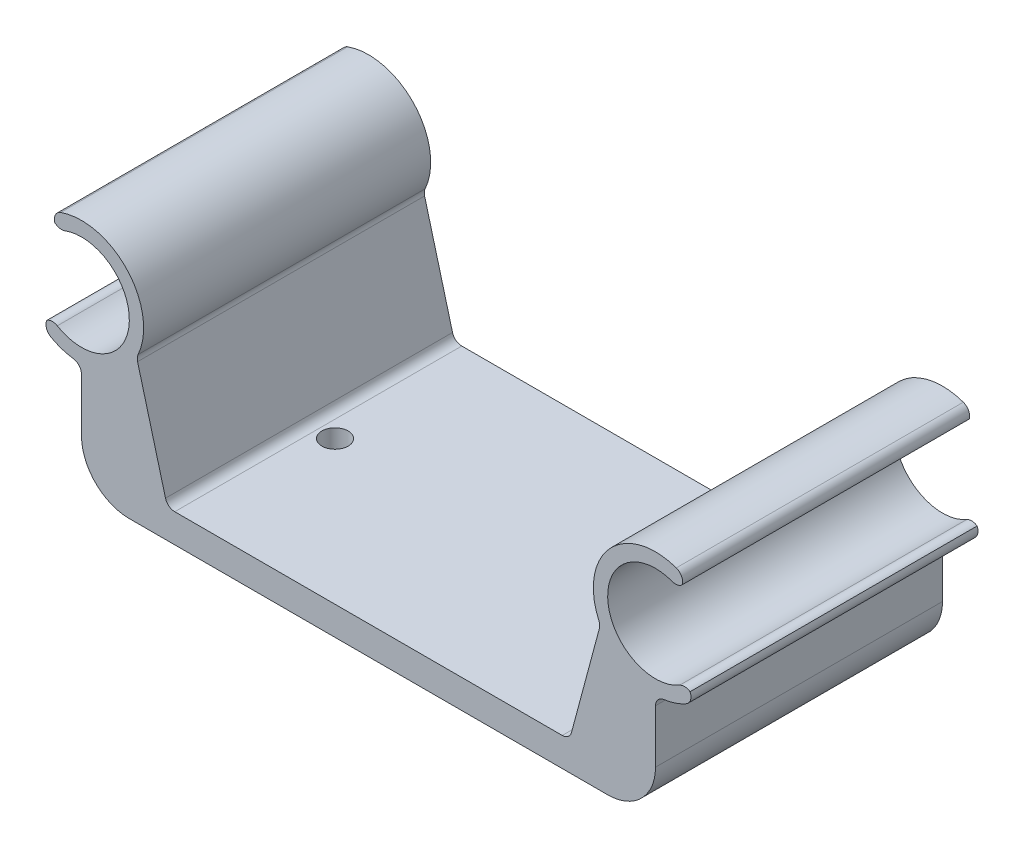
from build123d import *

# Parameters (mm, degrees)
BOSS_EXTRUDE1_DEPTH             = 3
CUT_EXTRUDE1_REACH              = 35.675
SKETCH2_R                       = 1.3750000000000009
BOSS_EXTRUDE2_REACH             = 35.675
BOSS_EXTRUDE2_DIRECTION_2_REACH = 35.675
FILLET3_R                       = 1
FILLET3_OF_MIRROR2_R            = 1
FILLET6_R                       = 5
FILLET7_R                       = 1


with BuildPart() as part:
    # Sketch1 → Boss-Extrude1 (new body)
    with BuildSketch(Plane(origin=(0, 0, 0), x_dir=(1, 0, 0), z_dir=(0, 1, 0))):
        Polygon((30, -14.999999999999993), (-29.999999999999996, -15.000000000000002), (-29.999999999999996, 14.999999999999998), (30.000000000000004, 15.000000000000005), align=None)
    extrude(amount=BOSS_EXTRUDE1_DEPTH)

    # Sketch2 → Cut-Extrude1 (cut, up to next)
    with BuildSketch(Plane(origin=(0, 3, 0), x_dir=(1, 0, 0), z_dir=(0, 1, 0)), mode=Mode.PRIVATE) as cut_extrude1_sk1:
        with Locations(Location((-18.5, 0, 0), (0, 0, 270))):
            Circle(SKETCH2_R)
    cut_extrude1_tool1 = extrude(cut_extrude1_sk1.sketch, amount=-CUT_EXTRUDE1_REACH, mode=Mode.PRIVATE) & part.part
    cut_extrude1 = cut_extrude1_tool1.solids().sort_by_distance((-18.5, 3, 0))[0]
    add(cut_extrude1, mode=Mode.SUBTRACT)

    # Mirror1: Cut-Extrude1 across plane
    add(cut_extrude1.mirror(Plane(origin=(0, 0, 0), x_dir=(0, 0, 1), z_dir=(1, 0, 0))), mode=Mode.SUBTRACT)

    # Boss-Extrude2: up to this face of the body (flat: up to its plane)
    boss_extrude2_end = Plane(part.part.faces().sort_by_distance((0, 1.5, 15))[0])
    # Sketch3 → Boss-Extrude2 (add, up to the picked face)
    with BuildSketch(Plane.XY, mode=Mode.PRIVATE) as boss_extrude2_sk1:
        with BuildLine():
            Line((24.23371870266459, 15.000000000000002), (21.01832839349107, 3))
            Line((21.01832839349107, 3), (30, 3))
            Line((30, 3), (29.999999999999996, 11.500000000107407))
            ThreePointArc((29.999999999999996, 11.500000000107407), (32.223130931464034, 11.891997965331278), (34.17811946267373, 13.020711120091907))
            Line((34.17811946267373, 13.020711120091907), (33.213938048141515, 14.169777784768357))
            ThreePointArc((33.213938048141515, 14.169777784768357), (25.019026509541703, 17.564221286256522), (32.50000000000003, 22.3301270189222))
            Line((32.50000000000003, 22.3301270189222), (33.250000000000036, 23.62916512459886))
            ThreePointArc((33.250000000000036, 23.62916512459886), (25.505721350569345, 22.695898148519827), (24.23371870266459, 15.000000000000002))
        make_face()
    boss_extrude2_tool1 = split(extrude(boss_extrude2_sk1.sketch, amount=BOSS_EXTRUDE2_REACH, mode=Mode.PRIVATE), bisect_by=boss_extrude2_end, keep=Keep.BOTH, mode=Mode.PRIVATE)
    boss_extrude2 = boss_extrude2_tool1.solids().sort_by(Axis((26.59731, 11.034621, 0), (0, 0, 1)))[0]
    add(boss_extrude2)

    # Boss-Extrude2 direction 2: up to this face of the body (flat: up to its plane)
    boss_extrude2_direction_2_end = Plane(part.part.faces().sort_by_distance((0, 1.5, -15))[0])
    # Sketch3 → Boss-Extrude2 direction 2 (add, up to the picked face)
    with BuildSketch(Plane.XY, mode=Mode.PRIVATE) as boss_extrude2_direction_2_sk1:
        with BuildLine():
            Line((24.23371870266459, 15.000000000000002), (21.01832839349107, 3))
            Line((21.01832839349107, 3), (30, 3))
            Line((30, 3), (29.999999999999996, 11.500000000107407))
            ThreePointArc((29.999999999999996, 11.500000000107407), (32.223130931464034, 11.891997965331278), (34.17811946267373, 13.020711120091907))
            Line((34.17811946267373, 13.020711120091907), (33.213938048141515, 14.169777784768357))
            ThreePointArc((33.213938048141515, 14.169777784768357), (25.019026509541703, 17.564221286256522), (32.50000000000003, 22.3301270189222))
            Line((32.50000000000003, 22.3301270189222), (33.250000000000036, 23.62916512459886))
            ThreePointArc((33.250000000000036, 23.62916512459886), (25.505721350569345, 22.695898148519827), (24.23371870266459, 15.000000000000002))
        make_face()
    boss_extrude2_direction_2_tool1 = split(extrude(boss_extrude2_direction_2_sk1.sketch, amount=-BOSS_EXTRUDE2_DIRECTION_2_REACH, mode=Mode.PRIVATE), bisect_by=boss_extrude2_direction_2_end, keep=Keep.BOTH, mode=Mode.PRIVATE)
    boss_extrude2_direction_2 = boss_extrude2_direction_2_tool1.solids().sort_by(Axis((26.59731, 11.034621, 0), (0, 0, -1)))[0]
    add(boss_extrude2_direction_2)

    # Fillet3
    # the kernel refuses this fillet: 1 mm, written as the material it adds along each edge
    with BuildSketch(Plane(origin=(29.999999999999996, 11.500000000107406, -15.000000000000002), x_dir=(0.9977653155349889, 0.06681597949116533, 0), z_dir=(0, 0, 1))) as fillet3_piece_1:
        with BuildLine():
            CenterArc((0.9354237099720605, -0.99776531555048), FILLET3_R, 93.83112782826316, 82.33774433018942)
            Line((-0.06234160556292847, -0.9309493360593146), (0, 0))
            ThreePointArc((0, 0), (0.4343038653561172, -0.01452544892746713), (0.8686077307122309, -1e-17))
        make_face()
    extrude(amount=30)
    # the kernel refuses this fillet: 1 mm, written as the material it takes off along each edge
    with BuildSketch(Plane(origin=(33.250000000000036, 23.62916512459886, 17.96693441323381), x_dir=(-0.9080543065649367, 0.4188524517403138, 0), z_dir=(0, 0, -1))) as fillet3_2_piece_1:
        with BuildLine():
            CenterArc((1.0954834756555598, -0.995824323371254), FILLET3_R, 84.76215915180506, 100.47568169639004)
            Line((0.09965915228430783, -1.0871146130092202), (0, 0))
            ThreePointArc((0, 0), (0.5933868826467665, 0.02714189808684594), (1.1867737652935233, 0))
        make_face()
    extrude(amount=35.93386882646762, mode=Mode.SUBTRACT)
    with BuildSketch(Plane(origin=(32.50000000000003, 22.3301270189222, -17.290199457863853), x_dir=(0.5000000000000039, 0.8660254037844365, 0), z_dir=(0, 0, 1))) as fillet3_2_piece_2:
        with BuildLine():
            CenterArc((0.9160797831455422, 0.9999999999999977), FILLET3_R, 189.59406822434758, 80.40593177565233)
            ThreePointArc((-0.06993351404503671, 0.8333333333765751), (-0.01751405270363253, 0.41813130141934185), (0, 0))
            Line((0, 0), (0.9160797831455412, -3e-17))
        make_face()
    extrude(amount=34.5803989157277, mode=Mode.SUBTRACT)
    with BuildSketch(Plane(origin=(34.17811946267373, 13.02071112009191, -17.96693441327771), x_dir=(-0.6427876096881444, 0.7660444431176312, 0), z_dir=(0, 0, 1))) as fillet3_2_piece_3:
        with BuildLine():
            CenterArc((1.0916730868583728, 1.0000000000000009), FILLET3_R, 169.52431830288586, 100.47568169711377)
            ThreePointArc((0.1083409208250382, 1.1818181818306124), (0.02714189812493758, 0.5933868826533465), (0, 0))
            Line((0, 0), (1.0916730868583666, -2e-17))
        make_face()
    extrude(amount=35.93386882655541, mode=Mode.SUBTRACT)
    with BuildSketch(Plane(origin=(33.213938048141515, 14.169777784768355, -17.29019945772614), x_dir=(-0.8171150585222966, -0.5764746144767381, 0), z_dir=(0, 0, 1))) as fillet3_2_piece_4:
        with BuildLine():
            CenterArc((0.9198888630675175, 0.9964971894548403), FILLET3_R, 184.7970341139915, 80.40593177249599)
            Line((-0.0766083263866242, 0.9128709291653951), (0, 0))
            ThreePointArc((0, 0), (0.4181313013932034, 0.01751405272528074), (0.8362626027864033, 2e-17))
        make_face()
    extrude(amount=34.58039891545228, mode=Mode.SUBTRACT)

    # Mirror2: Boss-Extrude2, Boss-Extrude2 direction 2 across plane
    add(boss_extrude2.mirror(Plane(origin=(0, 0, 0), x_dir=(0, 0, 1), z_dir=(1, 0, 0))))
    add(boss_extrude2_direction_2.mirror(Plane(origin=(0, 0, 0), x_dir=(0, 0, 1), z_dir=(1, 0, 0))))

    # Fillet3 of Mirror2
    # the kernel refuses this fillet: 1 mm, written as the material it adds along each edge
    with BuildSketch(Plane(origin=(-29.999999999999996, 11.500000000107406, 14.999999999999998), x_dir=(-0.9977653155349889, 0.06681597949116533, 0), z_dir=(0, 0, -1))) as fillet3_of_mirror2_piece_1:
        with BuildLine():
            CenterArc((0.9354237099720605, -0.99776531555048), FILLET3_OF_MIRROR2_R, 93.83112782826316, 82.33774433018942)
            Line((-0.06234160556292847, -0.9309493360593146), (0, 0))
            ThreePointArc((0, 0), (0.4343038653561172, -0.01452544892746713), (0.8686077307122309, -1e-17))
        make_face()
    extrude(amount=30)
    # the kernel refuses this fillet: 1 mm, written as the material it takes off along each edge
    with BuildSketch(Plane(origin=(-33.250000000000036, 23.629165124598856, 17.966934413233812), x_dir=(0.5000000000000044, -0.866025403784436, 0), z_dir=(0, 0, -1))) as fillet3_of_mirror2_2_piece_1:
        with BuildLine():
            CenterArc((1.0916730868040134, -1.0000000000000007), FILLET3_OF_MIRROR2_R, 90.00000000000007, 100.47568169639015)
            ThreePointArc((0.10834092076838271, -1.181818181818188), (0.02714189808684512, -0.5933868826467682), (0, 0))
            Line((0, 0), (1.091673086804012, -2e-17))
        make_face()
    extrude(amount=35.93386882646763, mode=Mode.SUBTRACT)
    with BuildSketch(Plane(origin=(-32.50000000000003, 22.3301270189222, 17.29019945786385), x_dir=(0.9048050109861938, 0.42582612894733674, 0), z_dir=(0, 0, -1))) as fillet3_of_mirror2_2_piece_2:
        with BuildLine():
            CenterArc((0.9198888631228366, -0.996497189454418), FILLET3_OF_MIRROR2_R, 94.79703411380164, 80.40593177565235)
            Line((-0.07660832633633094, -0.9128709292248977), (0, 0))
            ThreePointArc((0, 0), (0.41813130141834665, -0.01751405272739198), (0.8362626028366937, -2e-17))
        make_face()
    extrude(amount=34.5803989157277, mode=Mode.SUBTRACT)
    with BuildSketch(Plane(origin=(-34.17811946267373, 13.020711120091908, 17.966934413277702), x_dir=(0.8215259563306123, -0.5701711173630887, 0), z_dir=(0, 0, -1))) as fillet3_of_mirror2_2_piece_3:
        with BuildLine():
            CenterArc((1.0954834757069158, -0.995824323374353), FILLET3_OF_MIRROR2_R, 84.76215915375006, 100.47568169711377)
            Line((0.09965915233991275, -1.0871146130587033), (0, 0))
            ThreePointArc((0, 0), (0.59338688265553, 0.02714189807715625), (1.1867737653110744, 8e-17))
        make_face()
    extrude(amount=35.9338688265554, mode=Mode.SUBTRACT)
    with BuildSketch(Plane(origin=(-33.213938048141515, 14.169777784768355, 17.290199457726136), x_dir=(-0.6427876096881426, -0.7660444431176326, 0), z_dir=(0, 0, -1))) as fillet3_of_mirror2_2_piece_4:
        with BuildLine():
            CenterArc((0.916079783090449, -1.0000000000000009), FILLET3_OF_MIRROR2_R, 89.99999999999977, 80.40593177249599)
            ThreePointArc((-0.06993351409094786, -0.8333333333222552), (-0.01751405272878019, -0.4181313013930569), (0, 0))
            Line((0, 0), (0.916079783090453, 2e-17))
        make_face()
    extrude(amount=34.58039891545228, mode=Mode.SUBTRACT)

    # Fillet6
    fillet6_edges = [part.edges().sort_by_distance(p)[0] for p in [
        (30, 0, -5.33e-15),
        (-29.999999999999996, 0, 1.78e-15),
    ]]
    fillet(fillet6_edges, radius=FILLET6_R)

    # Fillet7
    fillet7_edges = [part.edges().sort_by_distance(p)[0] for p in [
        (21.01832839349107, 3, -1.78e-15),
        (24.23371870266459, 15.000000000000004, -1.78e-15),
        (-24.23371870266459, 15.000000000000004, -1.78e-15),
        (-21.01832839349107, 3, -1.78e-15),
    ]]
    fillet(fillet7_edges, radius=FILLET7_R)


solid = part.part
